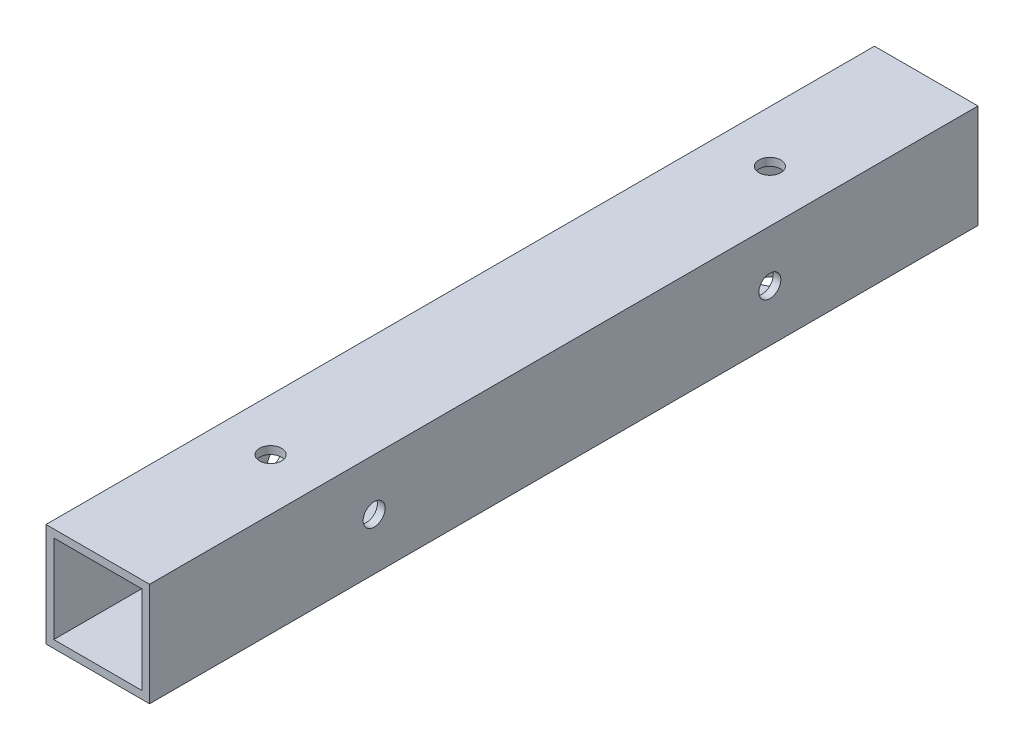
from build123d import *

# Parameters (mm, degrees)
SKETCH1_W           = 20
SKETCH1_H           = 20
SKETCH1_W_2         = 17
SKETCH1_H_2         = 17
BOSS_EXTRUDE1_DEPTH = 160
SKETCH2_R           = 2.125
CUT_EXTRUDE1_DEPTH  = 162.554944214
SKETCH3_R           = 2.125
CUT_EXTRUDE2_DEPTH  = 162.554944214


with BuildPart() as part:
    # Sketch1 → Boss-Extrude1 (new body)
    with BuildSketch(Plane.XY):
        Rectangle(SKETCH1_W, SKETCH1_H)
        Rectangle(SKETCH1_W_2, SKETCH1_H_2, mode=Mode.SUBTRACT)
    extrude(amount=-BOSS_EXTRUDE1_DEPTH)

    # Sketch2 → Cut-Extrude1 (cut, through all)
    with BuildSketch(Plane(origin=(0, 10, 0), x_dir=(1, 0, 0), z_dir=(0, 1, 0))):
        with Locations((0, 33.375)):
            Circle(SKETCH2_R)
        with Locations((0, 129.8)):
            Circle(SKETCH2_R)
    extrude(amount=-CUT_EXTRUDE1_DEPTH, mode=Mode.SUBTRACT)

    # Sketch3 → Cut-Extrude2 (cut, through all)
    with BuildSketch(Plane.ZY.offset(10)):
        with Locations((-43.375, 0)):
            Circle(SKETCH3_R)
        with Locations((-119.8, 0)):
            Circle(SKETCH3_R)
    extrude(amount=-CUT_EXTRUDE2_DEPTH, mode=Mode.SUBTRACT)


solid = part.part
